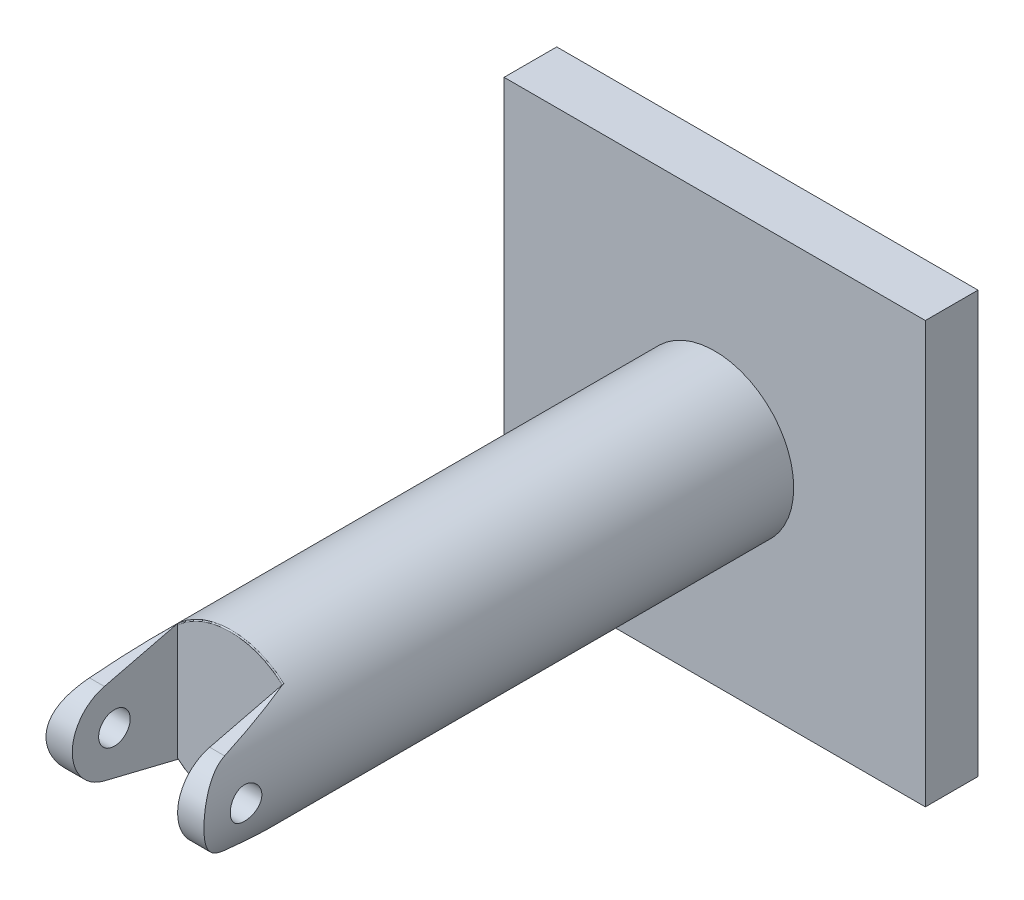
from build123d import *

# Parameters (mm, degrees)
SKETCH1_R               = 7.5
BOSS_EXTRUDE1_DEPTH     = 56
SKETCH2_W               = 10
SKETCH2_H               = 16
CUT_EXTRUDE1_DEPTH      = 10
CUT_EXTRUDE4_DEPTH      = 57.995613866
CUT_EXTRUDE4_DEPTH_BACK = 57.995613866
CUT_EXTRUDE5_DEPTH      = 57.995613991
CUT_EXTRUDE5_DEPTH_BACK = 57.995613991
SKETCH4_R               = 1.5
FILLET1_R               = 0.1
SKETCH5_W               = 40
SKETCH5_H               = 40
BOSS_EXTRUDE2_DEPTH     = 5


with BuildPart() as part:
    # Sketch1 → Boss-Extrude1 (new body)
    with BuildSketch(Plane.XY):
        Circle(SKETCH1_R)
    extrude(amount=BOSS_EXTRUDE1_DEPTH)

    # Sketch2 → Cut-Extrude1 (cut)
    with BuildSketch(Plane.XY.offset(56)):
        Rectangle(SKETCH2_W, SKETCH2_H)
    extrude(amount=-CUT_EXTRUDE1_DEPTH, mode=Mode.SUBTRACT)

    # Sketch3 → Cut-Extrude4 (cut, two sides: drawn at the far end of the back side and taken through both)
    with BuildSketch(Plane(origin=(0, 0, 0), x_dir=(0, 0, -1), z_dir=(1, 0, 0)).offset(-CUT_EXTRUDE4_DEPTH_BACK)):
        with BuildLine():
            Line((-46, -114.267763227), (-46, -7.5))
            Line((-46, -7.5), (-46, -5.590169944))
            Line((-46, -5.590169944), (-52.952744721, -3.885047998))
            ThreePointArc((-52.952744721, -3.885047998), (-55.999999999, -0.000262165), (-52.952923855, 3.884664175))
            Line((-52.952923855, 3.884664175), (-46, 5.590169944))
            Line((-46, 5.590169944), (-46, 7.5))
            Line((-46, 7.5), (-46, 114.267763227))
            Line((-46, 114.267763227), (-259.535526454, 114.267763227))
            Line((-259.535526454, 114.267763227), (-259.535526454, -114.267763227))
            Line((-259.535526454, -114.267763227), (-46, -114.267763227))
        make_face()
    extrude(amount=CUT_EXTRUDE4_DEPTH + CUT_EXTRUDE4_DEPTH_BACK, mode=Mode.SUBTRACT)

    # Sketch4 → Cut-Extrude5 (cut, two sides: drawn at the far end of the back side and taken through both)
    with BuildSketch(Plane(origin=(0, 0, 0), x_dir=(0, 0, -1), z_dir=(1, 0, 0)).offset(-CUT_EXTRUDE5_DEPTH_BACK)):
        with Locations(Location((-52, -0.000169944, 0), (0, 0, 0.006491373))):
            Circle(SKETCH4_R)
    extrude(amount=CUT_EXTRUDE5_DEPTH + CUT_EXTRUDE5_DEPTH_BACK, mode=Mode.SUBTRACT)

    # Fillet1
    # the kernel refuses this fillet: 0.1 mm, written as the material it takes off along each edge
    with BuildSketch(Plane(origin=(0, 0, 46), x_dir=(0.6911452834399255, -0.7227158481580054, 0), z_dir=(0.7227158481580054, 0.6911452834399255, 0))) as fillet1_piece_1_section:
        with BuildLine():
            CenterArc((7.5 - FILLET1_R, FILLET1_R), FILLET1_R, 270, 90)
            Line((7.5 - FILLET1_R, 0), (7.5, 0))
            Line((7.5, 0), (7.5, FILLET1_R))
        make_face()
    fillet1_piece_1 = revolve(axis=Axis((0, 0, 46), (0, 0, -1)), revolution_arc=87.441672972, mode=Mode.PRIVATE)
    fillet1_piece_1 = split(fillet1_piece_1, bisect_by=Plane(origin=(5, -5.569278278, 45.983069625), z_dir=(-1, 0, 0)), keep=Keep.TOP, mode=Mode.PRIVATE)
    fillet1_piece_1 = split(fillet1_piece_1, bisect_by=Plane(origin=(-5, -5.569278278, 45.983069625), z_dir=(1, 0, 0)), keep=Keep.TOP, mode=Mode.PRIVATE)
    add(fillet1_piece_1, mode=Mode.SUBTRACT)
    with BuildSketch(Plane(origin=(0, 0, 46), x_dir=(-0.6911452834399255, 0.7227158481580054, 0), z_dir=(-0.7227158481580054, -0.6911452834399255, 0))) as fillet1_piece_2_section:
        with BuildLine():
            CenterArc((7.5 - FILLET1_R, FILLET1_R), FILLET1_R, 270, 90)
            Line((7.5 - FILLET1_R, 0), (7.5, 0))
            Line((7.5, 0), (7.5, FILLET1_R))
        make_face()
    fillet1_piece_2 = revolve(axis=Axis((0, 0, 46), (0, 0, -1)), revolution_arc=87.441672972, mode=Mode.PRIVATE)
    fillet1_piece_2 = split(fillet1_piece_2, bisect_by=Plane(origin=(5, 5.569279246, 45.98306893), z_dir=(-1, 0, 0)), keep=Keep.TOP, mode=Mode.PRIVATE)
    fillet1_piece_2 = split(fillet1_piece_2, bisect_by=Plane(origin=(-5, 5.569279246, 45.98306893), z_dir=(1, 0, 0)), keep=Keep.TOP, mode=Mode.PRIVATE)
    add(fillet1_piece_2, mode=Mode.SUBTRACT)

    # Sketch5 → Boss-Extrude2 (add)
    with BuildSketch(Plane(origin=(0, 0, 0), x_dir=(-1, 0, 0), z_dir=(0, 0, -1))):
        Rectangle(SKETCH5_W, SKETCH5_H)
    extrude(amount=BOSS_EXTRUDE2_DEPTH)


solid = part.part
